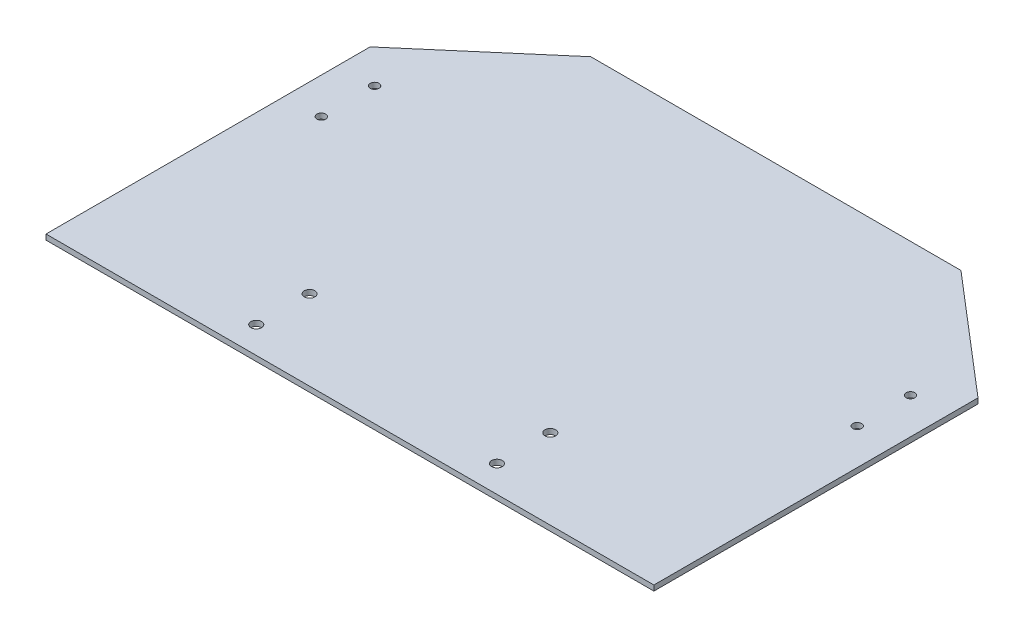
from build123d import *

# Parameters (mm, degrees)
RESSALTO_EXTRUS_O1_DEPTH = 2
ESBO_O3_R                = 2
CORTE_EXTRUS_O2_DEPTH    = 10
ESBO_O5_R                = 1.65
CORTE_EXTRUS_O5_DEPTH    = 2


with BuildPart() as part:
    # Esboço1 → Ressalto-extrusão1 (new body)
    with BuildSketch(Plane(origin=(0, 0, 0), x_dir=(1, 0, 0), z_dir=(0, 1, 0))):
        Polygon((-114, 41.685), (-114, -79.875), (114, -79.875), (114, 41.685), (69.415, 79.875), (-69.415, 79.875), align=None)
    extrude(amount=RESSALTO_EXTRUS_O1_DEPTH)

    # Esboço3 → Corte-extrusão2 (cut)
    with BuildSketch(Plane(origin=(0, 2, 0), x_dir=(1, 0, 0), z_dir=(0, 1, 0))):
        with Locations((-45.14, -69.875)):
            Circle(ESBO_O3_R)
        with Locations((45.14, -69.875)):
            Circle(ESBO_O3_R)
        with Locations((-45.14, -49.875)):
            Circle(ESBO_O3_R)
        with Locations((45.14, -49.875)):
            Circle(ESBO_O3_R)
    extrude(amount=-CORTE_EXTRUS_O2_DEPTH, mode=Mode.SUBTRACT)

    # Esboço5 → Corte-extrusão5 (cut)
    with BuildSketch(Plane(origin=(0, 2, 0), x_dir=(1, 0, 0), z_dir=(0, 1, 0))):
        with Locations((100.5, 29.876998266)):
            Circle(ESBO_O5_R)
        with Locations((100.5, 9.876998266)):
            Circle(ESBO_O5_R)
        with Locations((-100.5, 29.876998266)):
            Circle(ESBO_O5_R)
        with Locations((-100.5, 9.876998266)):
            Circle(ESBO_O5_R)
    extrude(amount=-CORTE_EXTRUS_O5_DEPTH, mode=Mode.SUBTRACT)


solid = part.part
